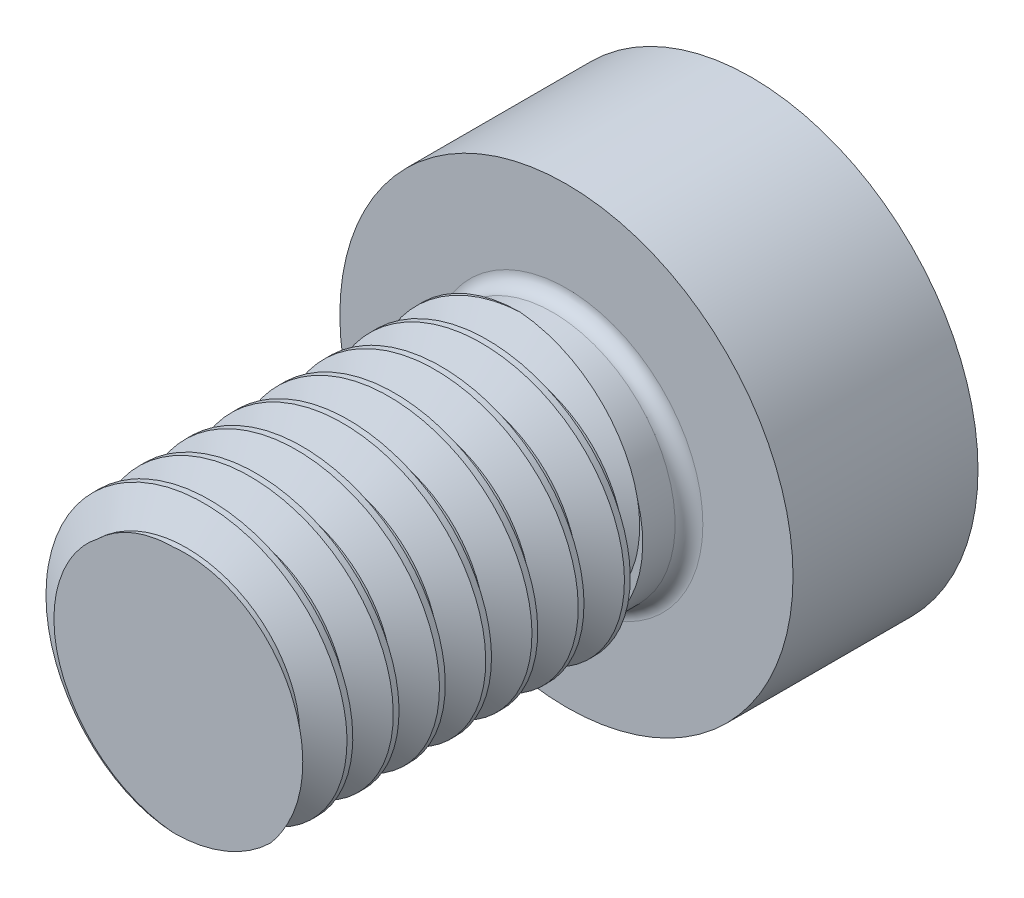
from build123d import *
from build123d.topology import SkipClean

# Parameters (mm, degrees)
SKETCH1_R           = 3
BOSS_EXTRUDE1_DEPTH = 50
CUT_SWEEP1_PITCH    = 1
BOSS_EXTRUDE2_DEPTH = 4
SKETCH6_OUTSIDE_W   = 26.472
SKETCH6_OUTSIDE_H   = 27.988
SKETCH6_OUTSIDE_R   = 4.9
CUT_EXTRUDE1_DEPTH  = 1
CUT_EXTRUDE1_DRAFT  = -60
SKETCH7_W           = 1
SKETCH7_H           = 3
SKETCH8_W           = 1
SKETCH8_H           = 0.35
FILLET1_R           = 0.3
SKETCH9_W           = 6.555622982
SKETCH9_H           = 6.510307616
CUT_EXTRUDE2_DEPTH  = 41.5
CUT_EXTRUDE3_DEPTH  = 3
SKETCH11_W          = 13.235802346
SKETCH11_H          = 12.333030076
SKETCH11_R          = 4.9
CUT_EXTRUDE4_DEPTH  = 6


with BuildPart() as part:
    # Sketch1 → Boss-Extrude1 (new body)
    with BuildSketch(Plane.XY):
        Circle(SKETCH1_R)
    extrude(amount=-BOSS_EXTRUDE1_DEPTH)

    # Cut-Sweep1: the profile of Sketch3 profile screwed along a right-hand helix of 52 turns, 6 arcs to a turn; built about Z, then put on its axis
    cut_sweep1_z = Axis((0, 0, 0), (0, 0, 1))
    cut_sweep1_corners = [(3.0003, 0, -0.875173205), (3.0003, 0, 0.000173205), (2.350480947, 0, -0.375), (2.350480947, 0, -0.5)]
    with BuildLine(mode=Mode.PRIVATE) as cut_sweep1_profile:
        Line(cut_sweep1_corners[0], cut_sweep1_corners[1])
        Line(cut_sweep1_corners[1], cut_sweep1_corners[2])
        Line(cut_sweep1_corners[2], cut_sweep1_corners[3])
        Line(cut_sweep1_corners[3], cut_sweep1_corners[0])
    cut_sweep1_cap = Face(cut_sweep1_profile.wire())
    cut_sweep1_turn_angles = [0, 30, 60, 90, 120, 150, 180, 210, 240, 270, 300, 330, 360, 390, 420, 450, 480, 510, 540, 570, 600, 630, 660, 690, 720]
    cut_sweep1_turn_weights = [1, 0.8660254037844387, 1, 0.8660254037844387, 1, 0.8660254037844387, 1, 0.8660254037844387, 1, 0.8660254037844387, 1, 0.8660254037844387, 1, 0.8660254037844387, 1, 0.8660254037844387, 1, 0.8660254037844387, 1, 0.8660254037844387, 1, 0.8660254037844387, 1, 0.8660254037844387, 1]
    cut_sweep1_turn_rails = [Edge.make_bspline([Vector(p[0], p[1], 0).rotate(cut_sweep1_z, cut_sweep1_turn_angles[k]) / cut_sweep1_turn_weights[k] + Vector(0, 0, p[2] + CUT_SWEEP1_PITCH * cut_sweep1_turn_angles[k] / 360) for k in range(25)], [0, 0, 0, 1, 1, 2, 2, 3, 3, 4, 4, 5, 5, 6, 6, 7, 7, 8, 8, 9, 9, 10, 10, 11, 11, 12, 12, 12], 2, cut_sweep1_turn_weights) for p in cut_sweep1_corners]
    cut_sweep1_turn_sides = [Face.make_surface_from_curves(cut_sweep1_turn_rails[p[0]], cut_sweep1_turn_rails[p[1]]) for p in [(0, 1), (1, 2), (2, 3), (3, 0)]]
    cut_sweep1 = Plane(origin=(0, 0, 0), x_dir=(0, 1, 0), z_dir=(0, 0, -1)) * Solid(Shell([*[p.moved(Location((0, 0, 2 * CUT_SWEEP1_PITCH * i))) for i in range(26) for p in cut_sweep1_turn_sides], cut_sweep1_cap, cut_sweep1_cap.rotate(cut_sweep1_z, 18720).moved(Location((0, 0, CUT_SWEEP1_PITCH * 18720 / 360)))]))
    add(cut_sweep1, mode=Mode.SUBTRACT)

    # Sketch4 → Cut-Revolve1 (revolve, cut)
    with BuildSketch(Plane(origin=(0, 0, 0), x_dir=(0, 0, -1), z_dir=(1, 0, 0)), mode=Mode.PRIVATE) as cut_revolve1_sk:
        Polygon((0, 3), (0.630186784, 3), (0, 2.1), align=None)
    revolve(cut_revolve1_sk.sketch.rotate(Axis((0, 0, -50), (0, 0, 1)), 90), axis=Axis((0, 0, -50), (0, 0, 1)), mode=Mode.SUBTRACT)

    # Sketch5 → Boss-Extrude2 (add)
    with BuildSketch(Plane(origin=(0, 0, -50), x_dir=(-1, 0, 0), z_dir=(0, 0, -1))):
        Polygon((4.9, -2.829016319), (4.9, 2.829016319), (0, 5.658032638), (-4.9, 2.829016319), (-4.9, -2.829016319), (0, -5.658032638), align=None)
    extrude(amount=BOSS_EXTRUDE2_DEPTH)


with BuildPart() as cut_extrude1_tool:
    # Sketch6 outside → Cut-Extrude1 (with draft: the straight prism first)
    with BuildSketch(Plane(origin=(0, 0, -54), x_dir=(-1, 0, 0), z_dir=(0, 0, -1))):
        Rectangle(SKETCH6_OUTSIDE_W, SKETCH6_OUTSIDE_H)
        Circle(SKETCH6_OUTSIDE_R, mode=Mode.SUBTRACT)
    extrude(amount=-CUT_EXTRUDE1_DEPTH)
    # Cut-Extrude1: the draft: its side faces are tilted about the plane it starts from
    cut_extrude1_sides = [cut_extrude1_tool.faces().sort_by_distance(p)[0] for p in [
        (0, -13.994, -53.5),
        (-13.236, 0, -53.5),
        (0, 13.994, -53.5),
        (13.236, 0, -53.5),
        (4.9, 0, -53.5),
    ]]
    draft(cut_extrude1_sides, Plane(origin=(0, 0, -54), x_dir=(-1, 0, 0), z_dir=(0, 0, -1)), CUT_EXTRUDE1_DRAFT)


with BuildPart() as part_1:
    add(part.part)

    # Cut-Extrude1: cut by cut_extrude1_tool
    add(cut_extrude1_tool.part, mode=Mode.SUBTRACT)

    # Sketch7 → Revolve1 (revolve)
    with SkipClean():  # the faces are left unmerged after this step: merging them gives an invalid solid
        with BuildSketch(Plane(origin=(0, 0, 0), x_dir=(0, 0, -1), z_dir=(1, 0, 0)), mode=Mode.PRIVATE) as revolve1_sk:
            with Locations((49.5, 1.5)):
                Rectangle(SKETCH7_W, SKETCH7_H)
        revolve(revolve1_sk.sketch.rotate(Axis((0, 0, -50), (0, 0, 1)), 90), axis=Axis((0, 0, -50), (0, 0, 1)))

    # Sketch8 → Cut-Revolve2 (revolve, cut)
    with BuildSketch(Plane(origin=(0, 0, 0), x_dir=(0, 0, -1), z_dir=(1, 0, 0)), mode=Mode.PRIVATE) as cut_revolve2_sk:
        with Locations((49.5, 2.825)):
            Rectangle(SKETCH8_W, SKETCH8_H)
    revolve(cut_revolve2_sk.sketch.rotate(Axis((0, 0, -50), (0, 0, 1)), 90), axis=Axis((0, 0, -50), (0, 0, 1)), mode=Mode.SUBTRACT)

    # Fillet1
    fillet1_edges = [part_1.edges().sort_by_distance(p)[0] for p in [
        (2.65, 0, -50),
    ]]
    fillet(fillet1_edges, radius=FILLET1_R)

    # Sketch9 → Cut-Extrude2 (cut)
    with BuildSketch(Plane.XY):
        Rectangle(SKETCH9_W, SKETCH9_H)
    extrude(amount=-CUT_EXTRUDE2_DEPTH, mode=Mode.SUBTRACT)

    # Sketch10 → Cut-Extrude3 (cut)
    with BuildSketch(Plane(origin=(0, 0, -54), x_dir=(-1, 0, 0), z_dir=(0, 0, -1))):
        Polygon((0, 2.886751346), (-2.5, 1.443375673), (-2.5, -1.443375673), (0, -2.886751346), (2.5, -1.443375673), (2.5, 1.443375673), align=None)
    extrude(amount=-CUT_EXTRUDE3_DEPTH, mode=Mode.SUBTRACT)

    # Sketch11 → Cut-Extrude4 (cut)
    with BuildSketch(Plane(origin=(0, 0, -54), x_dir=(-1, 0, 0), z_dir=(0, 0, -1))):
        Rectangle(SKETCH11_W, SKETCH11_H)
        Circle(SKETCH11_R, mode=Mode.SUBTRACT)
    extrude(amount=-CUT_EXTRUDE4_DEPTH, mode=Mode.SUBTRACT)


solid = part_1.part
